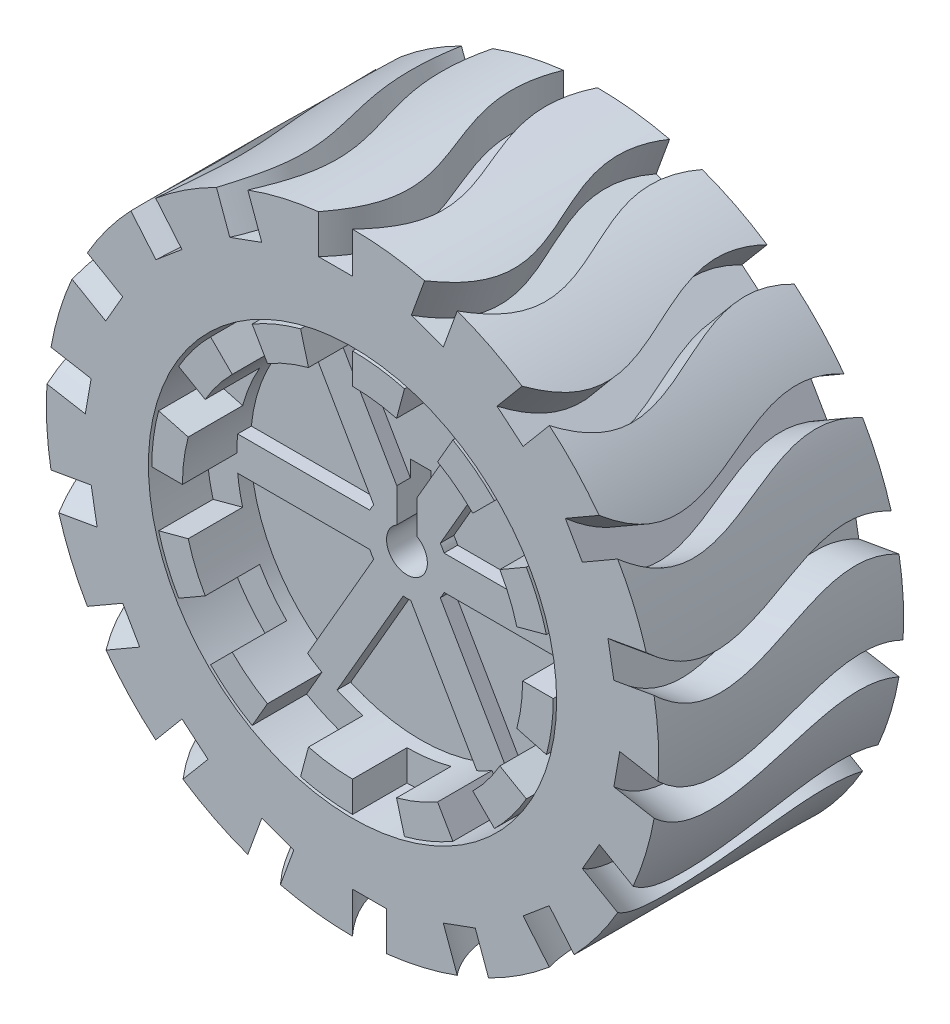
from build123d import *
from build123d.topology import SkipClean

# Parameters (mm, degrees)
SKETCH1_R            = 22.5
BOSS_EXTRUDE1_DEPTH  = 18
CUT_EXTRUDE1_DEPTH   = 5.5
CIRPATTERN1_START    = -22.500000114
CIRPATTERN1_DEPTH    = 3.000000114
CIRPATTERN1_START_2  = 19.5
CIRPATTERN1_2_DEPTH  = 3
CIRPATTERN1_3_DEPTH  = 3.000000114
CIRPATTERN1_4_DEPTH  = 3
CIRPATTERN1_5_DEPTH  = 3.000000114
CIRPATTERN1_6_DEPTH  = 3
CIRPATTERN1_7_DEPTH  = 3.000000114
CIRPATTERN1_8_DEPTH  = 3
CIRPATTERN1_9_DEPTH  = 3.000000114
CIRPATTERN1_10_DEPTH = 3
CIRPATTERN1_11_DEPTH = 3.000000114
CIRPATTERN1_12_DEPTH = 3
CIRPATTERN1_13_DEPTH = 3.000000114
CIRPATTERN1_14_DEPTH = 3
CIRPATTERN1_15_DEPTH = 3.000000114
CIRPATTERN1_16_DEPTH = 3
CIRPATTERN1_17_DEPTH = 3.000000114
SKETCH3_R            = 15
CUT_EXTRUDE2_DEPTH   = 18
SKETCH4_R            = 14.75
BOSS_EXTRUDE2_DEPTH  = 12
SKETCH5_R            = 14.75
CUT_EXTRUDE3_DEPTH   = 4
SKETCH6_R            = 12.5
SKETCH6_R_2          = 3
CUT_EXTRUDE4_DEPTH   = 1
SKETCH8_R            = 14.75
BOSS_EXTRUDE3_DEPTH  = 2
SKETCH10_R           = 12.5
SKETCH10_R_2         = 3
CUT_EXTRUDE5_DEPTH   = 1
CUT_EXTRUDE6_DEPTH   = 18
BOSS_EXTRUDE5_DEPTH  = 1
BOSS_EXTRUDE6_DEPTH  = 4


# Read off the part's stored shape, not the designer's step: CirPattern1
with BuildPart() as part:
    # Sketch1 → Boss-Extrude1 (new body)
    with BuildSketch(Plane.XY):
        Circle(SKETCH1_R)
    extrude(amount=BOSS_EXTRUDE1_DEPTH)

    # Sketch2 → Cut-Extrude1 (cut)
    with BuildSketch(Plane(origin=(0, 25, 0), x_dir=(1, 0, 0), z_dir=(0, 1, 0))):
        with BuildLine():
            Line((-2.5, 0), (0, 0))
            add(Edge.make_bspline(
                [(0, 0), (-3.296301702, -6.593771616), (5.89267884, -11.683586078), (0, -18)],
                knots=[0, 0, 0, 0, 1, 1, 1, 1], degree=3))
            Line((0, -18), (-2.5, -18))
            add(Edge.make_bspline(
                [(-2.5, 0), (-5.796301702, -6.593771616), (3.39267884, -11.683586078), (-2.5, -18)],
                knots=[0, 0, 0, 0, 1, 1, 1, 1], degree=3))
        make_face()
    extrude(amount=-CUT_EXTRUDE1_DEPTH, mode=Mode.SUBTRACT)

    # CirPattern1 outline → CirPattern1 (cut)
    with BuildSketch(Plane(origin=(0, 0, 0), x_dir=(0.9396926207859082, 0.3420201433256691, 0), z_dir=(0.3420201433256691, -0.9396926207859083, 0)).offset(CIRPATTERN1_START)):
        with BuildLine():
            Line((-2.5, 0), (0, 0))
            add(Edge.make_bspline(
                [(0, 0), (-3.296301702, 6.593771616), (5.89267884, 11.683586078), (0, 18)],
                knots=[0.64127667, 0.64127667, 0.64127667, 0.64127667, 1.64127667, 1.64127667, 1.64127667, 1.64127667], degree=3))
            Line((0, 18), (-2.5, 18))
            add(Edge.make_bspline(
                [(-2.5, 18), (3.39267884, 11.683586078), (-5.796301702, 6.593771616), (-2.5, 0)],
                knots=[0.909473215, 0.909473215, 0.909473215, 0.909473215, 1.909473215, 1.909473215, 1.909473215, 1.909473215], degree=3))
        make_face()
    extrude(amount=CIRPATTERN1_DEPTH, mode=Mode.SUBTRACT)

    # CirPattern1 2 outline → CirPattern1 2 (cut)
    with BuildSketch(Plane(origin=(0, 0, 0), x_dir=(0.9396926207859082, 0.3420201433256691, 0), z_dir=(0.3420201433256691, -0.9396926207859083, 0)).offset(CIRPATTERN1_START_2)):
        with BuildLine():
            Line((0, 0), (2.5, 0))
            add(Edge.make_bspline(
                [(2.5, 0), (5.796301702, 6.593771616), (-3.39267884, 11.683586078), (2.5, 18)],
                knots=[0, 0, 0, 0, 1, 1, 1, 1], degree=3))
            Line((2.5, 18), (0, 18))
            add(Edge.make_bspline(
                [(0, 18), (-5.89267884, 11.683586078), (3.296301702, 6.593771616), (0, 0)],
                knots=[0, 0, 0, 0, 1, 1, 1, 1], degree=3))
        make_face()
    extrude(amount=CIRPATTERN1_2_DEPTH, mode=Mode.SUBTRACT)

    # CirPattern1 3 outline → CirPattern1 3 (cut)
    with BuildSketch(Plane(origin=(0, 0, 0), x_dir=(0.7660444431189772, 0.6427876096865403, 0), z_dir=(0.6427876096865403, -0.7660444431189772, 0)).offset(CIRPATTERN1_START)):
        with BuildLine():
            Line((-2.5, 0), (0, 0))
            add(Edge.make_bspline(
                [(0, 0), (-3.296301702, 6.593771616), (5.89267884, 11.683586078), (0, 18)],
                knots=[0.64127667, 0.64127667, 0.64127667, 0.64127667, 1.64127667, 1.64127667, 1.64127667, 1.64127667], degree=3))
            Line((0, 18), (-2.5, 18))
            add(Edge.make_bspline(
                [(-2.5, 18), (3.39267884, 11.683586078), (-5.796301702, 6.593771616), (-2.5, 0)],
                knots=[0.909473215, 0.909473215, 0.909473215, 0.909473215, 1.909473215, 1.909473215, 1.909473215, 1.909473215], degree=3))
        make_face()
    extrude(amount=CIRPATTERN1_3_DEPTH, mode=Mode.SUBTRACT)

    # CirPattern1 4 outline → CirPattern1 4 (cut)
    with BuildSketch(Plane(origin=(0, 0, 0), x_dir=(0.7660444431189772, 0.6427876096865403, 0), z_dir=(0.6427876096865403, -0.7660444431189772, 0)).offset(CIRPATTERN1_START_2)):
        with BuildLine():
            Line((0, 0), (2.5, 0))
            add(Edge.make_bspline(
                [(2.5, 0), (5.796301702, 6.593771616), (-3.39267884, 11.683586078), (2.5, 18)],
                knots=[0, 0, 0, 0, 1, 1, 1, 1], degree=3))
            Line((2.5, 18), (0, 18))
            add(Edge.make_bspline(
                [(0, 18), (-5.89267884, 11.683586078), (3.296301702, 6.593771616), (0, 0)],
                knots=[0, 0, 0, 0, 1, 1, 1, 1], degree=3))
        make_face()
    extrude(amount=CIRPATTERN1_4_DEPTH, mode=Mode.SUBTRACT)

    # CirPattern1 5 outline → CirPattern1 5 (cut)
    with BuildSketch(Plane(origin=(0, 0, 0), x_dir=(0.49999999999999833, 0.8660254037844396, 0), z_dir=(0.8660254037844397, -0.49999999999999784, 0)).offset(CIRPATTERN1_START)):
        with BuildLine():
            Line((-2.5, 0), (0, 0))
            add(Edge.make_bspline(
                [(0, 0), (-3.296301702, 6.593771616), (5.89267884, 11.683586078), (0, 18)],
                knots=[0.64127667, 0.64127667, 0.64127667, 0.64127667, 1.64127667, 1.64127667, 1.64127667, 1.64127667], degree=3))
            Line((0, 18), (-2.5, 18))
            add(Edge.make_bspline(
                [(-2.5, 18), (3.39267884, 11.683586078), (-5.796301702, 6.593771616), (-2.5, 0)],
                knots=[0.909473215, 0.909473215, 0.909473215, 0.909473215, 1.909473215, 1.909473215, 1.909473215, 1.909473215], degree=3))
        make_face()
    extrude(amount=CIRPATTERN1_5_DEPTH, mode=Mode.SUBTRACT)

    # CirPattern1 6 outline → CirPattern1 6 (cut)
    with BuildSketch(Plane(origin=(0, 0, 0), x_dir=(0.49999999999999833, 0.8660254037844396, 0), z_dir=(0.8660254037844397, -0.49999999999999784, 0)).offset(CIRPATTERN1_START_2)):
        with BuildLine():
            Line((0, 0), (2.5, 0))
            add(Edge.make_bspline(
                [(2.5, 0), (5.796301702, 6.593771616), (-3.39267884, 11.683586078), (2.5, 18)],
                knots=[0, 0, 0, 0, 1, 1, 1, 1], degree=3))
            Line((2.5, 18), (0, 18))
            add(Edge.make_bspline(
                [(0, 18), (-5.89267884, 11.683586078), (3.296301702, 6.593771616), (0, 0)],
                knots=[0, 0, 0, 0, 1, 1, 1, 1], degree=3))
        make_face()
    extrude(amount=CIRPATTERN1_6_DEPTH, mode=Mode.SUBTRACT)

    # CirPattern1 7 outline → CirPattern1 7 (cut)
    with BuildSketch(Plane(origin=(0, 0, 0), x_dir=(0.1736481776669279, 0.9848077530122085, 0), z_dir=(0.9848077530122085, -0.1736481776669279, 0)).offset(CIRPATTERN1_START)):
        with BuildLine():
            Line((-2.5, 0), (0, 0))
            add(Edge.make_bspline(
                [(0, 0), (-3.296301702, 6.593771616), (5.89267884, 11.683586078), (0, 18)],
                knots=[0.64127667, 0.64127667, 0.64127667, 0.64127667, 1.64127667, 1.64127667, 1.64127667, 1.64127667], degree=3))
            Line((0, 18), (-2.5, 18))
            add(Edge.make_bspline(
                [(-2.5, 18), (3.39267884, 11.683586078), (-5.796301702, 6.593771616), (-2.5, 0)],
                knots=[0.909473215, 0.909473215, 0.909473215, 0.909473215, 1.909473215, 1.909473215, 1.909473215, 1.909473215], degree=3))
        make_face()
    extrude(amount=CIRPATTERN1_7_DEPTH, mode=Mode.SUBTRACT)

    # CirPattern1 8 outline → CirPattern1 8 (cut)
    with BuildSketch(Plane(origin=(0, 0, 0), x_dir=(0.1736481776669279, 0.9848077530122085, 0), z_dir=(0.9848077530122085, -0.1736481776669279, 0)).offset(CIRPATTERN1_START_2)):
        with BuildLine():
            Line((0, 0), (2.5, 0))
            add(Edge.make_bspline(
                [(2.5, 0), (5.796301702, 6.593771616), (-3.39267884, 11.683586078), (2.5, 18)],
                knots=[0, 0, 0, 0, 1, 1, 1, 1], degree=3))
            Line((2.5, 18), (0, 18))
            add(Edge.make_bspline(
                [(0, 18), (-5.89267884, 11.683586078), (3.296301702, 6.593771616), (0, 0)],
                knots=[0, 0, 0, 0, 1, 1, 1, 1], degree=3))
        make_face()
    extrude(amount=CIRPATTERN1_8_DEPTH, mode=Mode.SUBTRACT)

    # CirPattern1 9 outline → CirPattern1 9 (cut)
    with BuildSketch(Plane(origin=(0, 0, 0), x_dir=(-0.17364817766693394, 0.9848077530122075, 0), z_dir=(0.9848077530122076, 0.1736481776669339, 0)).offset(CIRPATTERN1_START)):
        with BuildLine():
            Line((-2.5, 0), (0, 0))
            add(Edge.make_bspline(
                [(0, 0), (-3.296301702, 6.593771616), (5.89267884, 11.683586078), (0, 18)],
                knots=[0.64127667, 0.64127667, 0.64127667, 0.64127667, 1.64127667, 1.64127667, 1.64127667, 1.64127667], degree=3))
            Line((0, 18), (-2.5, 18))
            add(Edge.make_bspline(
                [(-2.5, 18), (3.39267884, 11.683586078), (-5.796301702, 6.593771616), (-2.5, 0)],
                knots=[0.909473215, 0.909473215, 0.909473215, 0.909473215, 1.909473215, 1.909473215, 1.909473215, 1.909473215], degree=3))
        make_face()
    extrude(amount=CIRPATTERN1_9_DEPTH, mode=Mode.SUBTRACT)

    # CirPattern1 10 outline → CirPattern1 10 (cut)
    with BuildSketch(Plane(origin=(0, 0, 0), x_dir=(-0.17364817766693394, 0.9848077530122075, 0), z_dir=(0.9848077530122076, 0.1736481776669339, 0)).offset(CIRPATTERN1_START_2)):
        with BuildLine():
            Line((0, 0), (2.5, 0))
            add(Edge.make_bspline(
                [(2.5, 0), (5.796301702, 6.593771616), (-3.39267884, 11.683586078), (2.5, 18)],
                knots=[0, 0, 0, 0, 1, 1, 1, 1], degree=3))
            Line((2.5, 18), (0, 18))
            add(Edge.make_bspline(
                [(0, 18), (-5.89267884, 11.683586078), (3.296301702, 6.593771616), (0, 0)],
                knots=[0, 0, 0, 0, 1, 1, 1, 1], degree=3))
        make_face()
    extrude(amount=CIRPATTERN1_10_DEPTH, mode=Mode.SUBTRACT)

    # CirPattern1 11 outline → CirPattern1 11 (cut)
    with BuildSketch(Plane(origin=(0, 0, 0), x_dir=(0.5000000000000041, -0.8660254037844364, 0), z_dir=(0.8660254037844364, 0.5000000000000037, 0)).offset(CIRPATTERN1_START)):
        with BuildLine():
            Line((2.5, 0), (0, 0))
            add(Edge.make_bspline(
                [(0, 0), (3.296301702, -6.593771616), (-5.89267884, -11.683586078), (0, -18)],
                knots=[0.64127667, 0.64127667, 0.64127667, 0.64127667, 1.64127667, 1.64127667, 1.64127667, 1.64127667], degree=3))
            Line((0, -18), (2.5, -18))
            add(Edge.make_bspline(
                [(2.5, -18), (-3.39267884, -11.683586078), (5.796301702, -6.593771616), (2.5, 0)],
                knots=[0.909473215, 0.909473215, 0.909473215, 0.909473215, 1.909473215, 1.909473215, 1.909473215, 1.909473215], degree=3))
        make_face()
    extrude(amount=CIRPATTERN1_11_DEPTH, mode=Mode.SUBTRACT)

    # CirPattern1 12 outline → CirPattern1 12 (cut)
    with BuildSketch(Plane(origin=(0, 0, 0), x_dir=(0.5000000000000041, -0.8660254037844364, 0), z_dir=(0.8660254037844364, 0.5000000000000037, 0)).offset(CIRPATTERN1_START_2)):
        with BuildLine():
            Line((0, 0), (-2.5, 0))
            add(Edge.make_bspline(
                [(-2.5, 0), (-5.796301702, -6.593771616), (3.39267884, -11.683586078), (-2.5, -18)],
                knots=[0, 0, 0, 0, 1, 1, 1, 1], degree=3))
            Line((-2.5, -18), (0, -18))
            add(Edge.make_bspline(
                [(0, -18), (5.89267884, -11.683586078), (-3.296301702, -6.593771616), (0, 0)],
                knots=[0, 0, 0, 0, 1, 1, 1, 1], degree=3))
        make_face()
    extrude(amount=CIRPATTERN1_12_DEPTH, mode=Mode.SUBTRACT)

    # CirPattern1 13 outline → CirPattern1 13 (cut)
    with BuildSketch(Plane(origin=(0, 0, 0), x_dir=(0.7660444431189815, -0.6427876096865353, 0), z_dir=(0.6427876096865353, 0.7660444431189813, 0)).offset(CIRPATTERN1_START)):
        with BuildLine():
            Line((2.5, 0), (0, 0))
            add(Edge.make_bspline(
                [(0, 0), (3.296301702, -6.593771616), (-5.89267884, -11.683586078), (0, -18)],
                knots=[0.64127667, 0.64127667, 0.64127667, 0.64127667, 1.64127667, 1.64127667, 1.64127667, 1.64127667], degree=3))
            Line((0, -18), (2.5, -18))
            add(Edge.make_bspline(
                [(2.5, -18), (-3.39267884, -11.683586078), (5.796301702, -6.593771616), (2.5, 0)],
                knots=[0.909473215, 0.909473215, 0.909473215, 0.909473215, 1.909473215, 1.909473215, 1.909473215, 1.909473215], degree=3))
        make_face()
    extrude(amount=CIRPATTERN1_13_DEPTH, mode=Mode.SUBTRACT)

    # CirPattern1 14 outline → CirPattern1 14 (cut)
    with BuildSketch(Plane(origin=(0, 0, 0), x_dir=(0.7660444431189815, -0.6427876096865353, 0), z_dir=(0.6427876096865353, 0.7660444431189813, 0)).offset(CIRPATTERN1_START_2)):
        with BuildLine():
            Line((0, 0), (-2.5, 0))
            add(Edge.make_bspline(
                [(-2.5, 0), (-5.796301702, -6.593771616), (3.39267884, -11.683586078), (-2.5, -18)],
                knots=[0, 0, 0, 0, 1, 1, 1, 1], degree=3))
            Line((-2.5, -18), (0, -18))
            add(Edge.make_bspline(
                [(0, -18), (5.89267884, -11.683586078), (-3.296301702, -6.593771616), (0, 0)],
                knots=[0, 0, 0, 0, 1, 1, 1, 1], degree=3))
        make_face()
    extrude(amount=CIRPATTERN1_14_DEPTH, mode=Mode.SUBTRACT)

    # CirPattern1 15 outline → CirPattern1 15 (cut)
    with BuildSketch(Plane(origin=(0, 0, 0), x_dir=(0.9396926207859104, -0.3420201433256631, 0), z_dir=(0.34202014332566316, 0.9396926207859103, 0)).offset(CIRPATTERN1_START)):
        with BuildLine():
            Line((2.5, 0), (0, 0))
            add(Edge.make_bspline(
                [(0, 0), (3.296301702, -6.593771616), (-5.89267884, -11.683586078), (0, -18)],
                knots=[0.64127667, 0.64127667, 0.64127667, 0.64127667, 1.64127667, 1.64127667, 1.64127667, 1.64127667], degree=3))
            Line((0, -18), (2.5, -18))
            add(Edge.make_bspline(
                [(2.5, -18), (-3.39267884, -11.683586078), (5.796301702, -6.593771616), (2.5, 0)],
                knots=[0.909473215, 0.909473215, 0.909473215, 0.909473215, 1.909473215, 1.909473215, 1.909473215, 1.909473215], degree=3))
        make_face()
    extrude(amount=CIRPATTERN1_15_DEPTH, mode=Mode.SUBTRACT)

    # CirPattern1 16 outline → CirPattern1 16 (cut)
    with BuildSketch(Plane(origin=(0, 0, 0), x_dir=(0.9396926207859104, -0.3420201433256631, 0), z_dir=(0.34202014332566316, 0.9396926207859103, 0)).offset(CIRPATTERN1_START_2)):
        with BuildLine():
            Line((0, 0), (-2.5, 0))
            add(Edge.make_bspline(
                [(-2.5, 0), (-5.796301702, -6.593771616), (3.39267884, -11.683586078), (-2.5, -18)],
                knots=[0, 0, 0, 0, 1, 1, 1, 1], degree=3))
            Line((-2.5, -18), (0, -18))
            add(Edge.make_bspline(
                [(0, -18), (5.89267884, -11.683586078), (-3.296301702, -6.593771616), (0, 0)],
                knots=[0, 0, 0, 0, 1, 1, 1, 1], degree=3))
        make_face()
    extrude(amount=CIRPATTERN1_16_DEPTH, mode=Mode.SUBTRACT)

    # CirPattern1 17 outline → CirPattern1 17 (cut)
    with BuildSketch(Plane(origin=(0, 0, 0), x_dir=(1, 0, 0), z_dir=(0, 1, 0)).offset(CIRPATTERN1_START)):
        with BuildLine():
            add(Edge.make_bspline(
                [(2.5, 0), (5.796301702, -6.593771616), (-3.39267884, -11.683586078), (2.5, -18)],
                knots=[0, 0, 0, 0, 1, 1, 1, 1], degree=3))
            Line((2.5, 0), (0, 0))
            add(Edge.make_bspline(
                [(0, -18), (-5.89267884, -11.683586078), (3.296301702, -6.593771616), (0, 0)],
                knots=[0, 0, 0, 0, 1, 1, 1, 1], degree=3))
            Line((0, -18), (2.5, -18))
        make_face()
    extrude(amount=CIRPATTERN1_17_DEPTH, mode=Mode.SUBTRACT)

    # Sketch3 → Cut-Extrude2 (cut)
    with BuildSketch(Plane.XY.offset(18)):
        Circle(SKETCH3_R)
    extrude(amount=-CUT_EXTRUDE2_DEPTH, mode=Mode.SUBTRACT)


with BuildPart() as body_2:
    # Sketch4 → Boss-Extrude2 (new body)
    with BuildSketch(Plane.XY):
        Circle(SKETCH4_R)
    extrude(amount=BOSS_EXTRUDE2_DEPTH)

    # Sketch5 → Cut-Extrude3 (cut)
    with BuildSketch(Plane(origin=(0, 0, 0), x_dir=(-1, 0, 0), z_dir=(0, 0, -1))):
        Circle(SKETCH5_R)
    extrude(amount=-CUT_EXTRUDE3_DEPTH, mode=Mode.SUBTRACT)

    # Sketch6 → Cut-Extrude4 (cut)
    with BuildSketch(Plane(origin=(0, 0, 4), x_dir=(-1, 0, 0), z_dir=(0, 0, -1))):
        Circle(SKETCH6_R)
        Circle(SKETCH6_R_2, mode=Mode.SUBTRACT)
    extrude(amount=-CUT_EXTRUDE4_DEPTH, mode=Mode.SUBTRACT)

    # Sketch8 → Boss-Extrude3 (add)
    with BuildSketch(Plane.XY.offset(12)):
        with Locations(Location((0, 0, 0), (0, 0, 180))):
            Circle(SKETCH8_R)
    extrude(amount=BOSS_EXTRUDE3_DEPTH)

    # Sketch10 → Cut-Extrude5 (cut)
    with BuildSketch(Plane.XY.offset(14)):
        with Locations(Location((0, 0, 0), (0, 0, 180))):
            Circle(SKETCH10_R)
        with Locations(Location((0, 0, 0), (0, 0, 180))):
            Circle(SKETCH10_R_2, mode=Mode.SUBTRACT)
    extrude(amount=-CUT_EXTRUDE5_DEPTH, mode=Mode.SUBTRACT)

    # Sketch7 → Cut-Extrude6 (cut)
    with BuildSketch(Plane(origin=(0, 0, 4), x_dir=(-1, 0, 0), z_dir=(0, 0, -1))):
        with BuildLine():
            Line((-0.75, 1.299038106), (-0.75, 5))
            Line((-0.75, 5), (0.75, 5))
            Line((0.75, 5), (0.75, 1.299038106))
            ThreePointArc((0.75, 1.299038106), (0, -1.5), (-0.75, 1.299038106))
        make_face()
    extrude(amount=-CUT_EXTRUDE6_DEPTH, mode=Mode.SUBTRACT)

    # Sketch12 → Boss-Extrude5 (add)
    with SkipClean():  # the faces are left unmerged after this step: merging them gives an invalid solid
        with BuildSketch(Plane.XY.offset(14)):
            with BuildLine():
                ThreePointArc((0.75, 1.299038106), (0.789958707, 1.275133421), (0.829156198, 1.25))
                Line((0.829156198, 1.25), (2.165063509, 1.25))
                Line((2.165063509, 1.25), (7.604332458, 10.671090174))
                Line((7.604332458, 10.671090174), (5.439268948, 11.921090174))
                Line((5.439268948, 11.921090174), (0.75, 3.799038106))
                Line((0.75, 3.799038106), (0.75, 1.299038106))
            make_face()
            with BuildLine():
                ThreePointArc((-0.667953656, -1.343070331), (-0.75, -1.299038106), (-0.829156198, -1.25))
                Line((-0.829156198, -1.25), (-2.165063509, -1.25))
                Line((-2.165063509, -1.25), (-7.604332458, -10.671090174))
                Line((-7.604332458, -10.671090174), (-5.439268948, -11.921090174))
                Line((-5.439268948, -11.921090174), (0, -2.5))
                Line((0, -2.5), (-0.667953656, -1.343070331))
            make_face()
            with BuildLine():
                Line((2.165063509, -1.25), (0.829156198, -1.25))
                ThreePointArc((0.829156198, -1.25), (0.75, -1.299038106), (0.667953656, -1.343070331))
                Line((0.667953656, -1.343070331), (0, -2.5))
                Line((0, -2.5), (5.439268948, -11.921090174))
                Line((5.439268948, -11.921090174), (7.604332458, -10.671090174))
                Line((7.604332458, -10.671090174), (2.165063509, -1.25))
            make_face()
            with BuildLine():
                Line((2.165063509, 1.25), (1.497109854, 0.093070331))
                ThreePointArc((1.497109854, 0.093070331), (1.5, 0), (1.497109854, -0.093070331))
                Line((1.497109854, -0.093070331), (2.165063509, -1.25))
                Line((2.165063509, -1.25), (13.043601406, -1.25))
                Line((13.043601406, -1.25), (13.043601406, 1.25))
                Line((13.043601406, 1.25), (2.165063509, 1.25))
            make_face()
            with BuildLine():
                ThreePointArc((-1.497109854, -0.093070331), (-1.5, 0), (-1.497109854, 0.093070331))
                Line((-1.497109854, 0.093070331), (-2.165063509, 1.25))
                Line((-2.165063509, 1.25), (-13.043601406, 1.25))
                Line((-13.043601406, 1.25), (-13.043601406, -1.25))
                Line((-13.043601406, -1.25), (-2.165063509, -1.25))
                Line((-2.165063509, -1.25), (-1.497109854, -0.093070331))
            make_face()
            with BuildLine():
                Line((-2.165063509, 1.25), (-0.829156198, 1.25))
                ThreePointArc((-0.829156198, 1.25), (-0.789958707, 1.275133421), (-0.75, 1.299038106))
                Line((-0.75, 1.299038106), (-0.75, 3.799038106))
                Line((-0.75, 3.799038106), (-5.439268948, 11.921090174))
                Line((-5.439268948, 11.921090174), (-7.604332458, 10.671090174))
                Line((-7.604332458, 10.671090174), (-2.165063509, 1.25))
            make_face()
        extrude(amount=-BOSS_EXTRUDE5_DEPTH)

    # Sketch13 → Boss-Extrude6 (add)
    with SkipClean():  # the faces are left unmerged after this step: merging them gives an invalid solid
        with BuildSketch(Plane.XY.offset(14)):
            with BuildLine():
                Line((12.5, 0), (14.75, 0))
                ThreePointArc((14.75, 0), (14.623811705, -1.925261335), (14.247405938, -3.817580915))
                Line((14.247405938, -3.817580915), (12.074072829, -3.235238064))
                ThreePointArc((12.074072829, -3.235238064), (12.393060767, -1.631577403), (12.5, 0))
            make_face()
            with BuildLine():
                Line((10.825317547, -6.25), (12.773874706, -7.375))
                ThreePointArc((12.773874706, -7.375), (11.701961769, -8.979231078), (10.429825023, -10.429825023))
                Line((10.429825023, -10.429825023), (8.838834765, -8.838834765))
                ThreePointArc((8.838834765, -8.838834765), (9.916916754, -7.609517863), (10.825317547, -6.25))
            make_face()
            with BuildLine():
                Line((6.25, -10.825317547), (7.375, -12.773874706))
                ThreePointArc((7.375, -12.773874706), (5.644580627, -13.627223105), (3.817580915, -14.247405938))
                Line((3.817580915, -14.247405938), (3.235238064, -12.074072829))
                ThreePointArc((3.235238064, -12.074072829), (4.783542905, -11.548494156), (6.25, -10.825317547))
            make_face()
            with BuildLine():
                Line((0, -12.5), (0, -14.75))
                ThreePointArc((0, -14.75), (-1.925261335, -14.623811705), (-3.817580915, -14.247405938))
                Line((-3.817580915, -14.247405938), (-3.235238064, -12.074072829))
                ThreePointArc((-3.235238064, -12.074072829), (-1.631577403, -12.393060767), (0, -12.5))
            make_face()
            with BuildLine():
                Line((-6.25, -10.825317547), (-7.375, -12.773874706))
                ThreePointArc((-7.375, -12.773874706), (-8.979231078, -11.701961769), (-10.429825023, -10.429825023))
                Line((-10.429825023, -10.429825023), (-8.838834765, -8.838834765))
                ThreePointArc((-8.838834765, -8.838834765), (-7.609517863, -9.916916754), (-6.25, -10.825317547))
            make_face()
            with BuildLine():
                Line((-10.825317547, -6.25), (-12.773874706, -7.375))
                ThreePointArc((-12.773874706, -7.375), (-13.627223105, -5.644580627), (-14.247405938, -3.817580915))
                Line((-14.247405938, -3.817580915), (-12.074072829, -3.235238064))
                ThreePointArc((-12.074072829, -3.235238064), (-11.548494156, -4.783542905), (-10.825317547, -6.25))
            make_face()
            with BuildLine():
                Line((-12.5, 0), (-14.75, 0))
                ThreePointArc((-14.75, 0), (-14.623811705, 1.925261335), (-14.247405938, 3.817580915))
                Line((-14.247405938, 3.817580915), (-12.074072829, 3.235238064))
                ThreePointArc((-12.074072829, 3.235238064), (-12.393060767, 1.631577403), (-12.5, 0))
            make_face()
            with BuildLine():
                Line((-10.825317547, 6.25), (-12.773874706, 7.375))
                ThreePointArc((-12.773874706, 7.375), (-11.701961769, 8.979231078), (-10.429825023, 10.429825023))
                Line((-10.429825023, 10.429825023), (-8.838834765, 8.838834765))
                ThreePointArc((-8.838834765, 8.838834765), (-9.916916754, 7.609517863), (-10.825317547, 6.25))
            make_face()
            with BuildLine():
                Line((-6.25, 10.825317547), (-7.375, 12.773874706))
                ThreePointArc((-7.375, 12.773874706), (-5.644580627, 13.627223105), (-3.817580915, 14.247405938))
                Line((-3.817580915, 14.247405938), (-3.235238064, 12.074072829))
                ThreePointArc((-3.235238064, 12.074072829), (-4.783542905, 11.548494156), (-6.25, 10.825317547))
            make_face()
            with BuildLine():
                Line((0, 12.5), (0, 14.75))
                ThreePointArc((0, 14.75), (1.925261335, 14.623811705), (3.817580915, 14.247405938))
                Line((3.817580915, 14.247405938), (3.235238064, 12.074072829))
                ThreePointArc((3.235238064, 12.074072829), (1.631577403, 12.393060767), (0, 12.5))
            make_face()
            with BuildLine():
                Line((6.25, 10.825317547), (7.375, 12.773874706))
                ThreePointArc((7.375, 12.773874706), (8.979231078, 11.701961769), (10.429825023, 10.429825023))
                Line((10.429825023, 10.429825023), (8.838834765, 8.838834765))
                ThreePointArc((8.838834765, 8.838834765), (7.609517863, 9.916916754), (6.25, 10.825317547))
            make_face()
            with BuildLine():
                Line((10.825317547, 6.25), (12.773874706, 7.375))
                ThreePointArc((12.773874706, 7.375), (13.627223105, 5.644580627), (14.247405938, 3.817580915))
                Line((14.247405938, 3.817580915), (12.074072829, 3.235238064))
                ThreePointArc((12.074072829, 3.235238064), (11.548494156, 4.783542905), (10.825317547, 6.25))
            make_face()
        extrude(amount=BOSS_EXTRUDE6_DEPTH)


solid = Compound([part.part, body_2.part])
